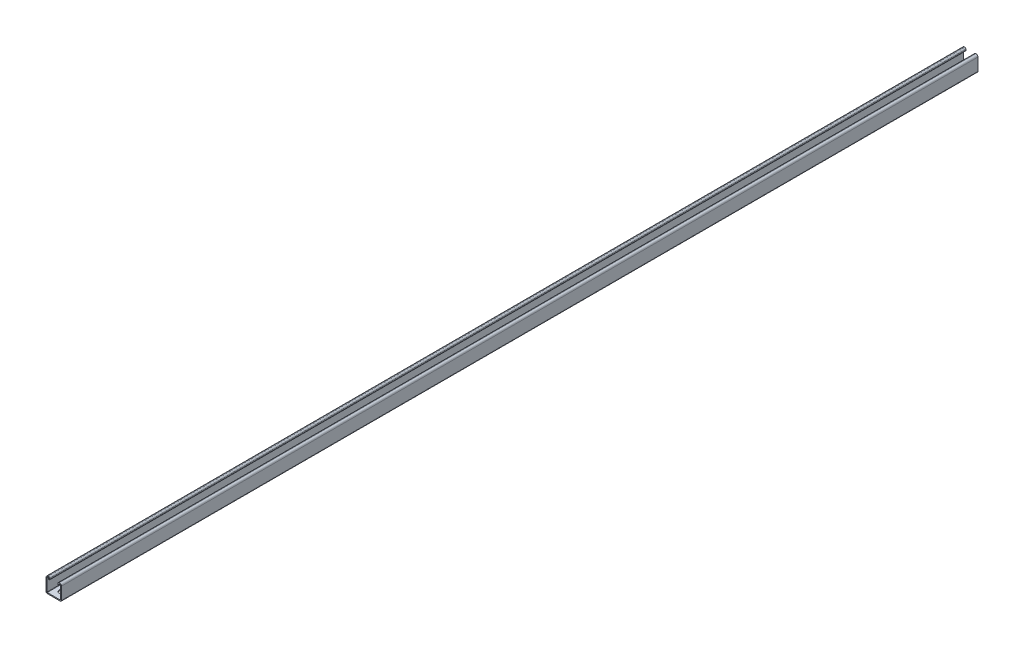
from build123d import *

# Parameters (mm, degrees)
PRIMARY_EXTRUSION_DEPTH = 2438.4
SLOT_CUT_REACH          = 2440.837
LPATTERN1_COUNT         = 48
LPATTERN1_PITCH         = 50.8


with BuildPart() as part:
    # Sketch1 → Primary Extrusion (new body)
    with BuildSketch(Plane.XY):
        with BuildLine():
            Line((17.176891111, -17.970376528), (-17.176891111, -17.970376528))
            ThreePointArc((-17.176891111, -17.970376528), (-17.738157147, -17.737892523), (-17.970641152, -17.176626487))
            Line((-17.970641152, -17.176626487), (-17.970641152, 15.589126408))
            ThreePointArc((-17.970641152, 15.589126408), (-17.273189139, 17.272924515), (-15.589391032, 17.970376528))
            Line((-15.589391032, 17.970376528), (-14.57342631, 17.970376528))
            ThreePointArc((-14.57342631, 17.970376528), (-14.012171972, 17.737897369), (-13.779692813, 17.176643031))
            Line((-13.779692813, 17.176643031), (-13.779692813, 14.833457753))
            ThreePointArc((-13.779692813, 14.833457753), (-12.446175174, 13.499940114), (-11.112657535, 14.833457753))
            Line((-11.112657535, 14.833457753), (-11.112657535, 17.176643031))
            ThreePointArc((-11.112657535, 17.176643031), (-12.126293241, 19.623776099), (-14.57342631, 20.637411806))
            Line((-14.57342631, 20.637411806), (-15.589391032, 20.637411806))
            ThreePointArc((-15.589391032, 20.637411806), (-19.15906787, 19.158803246), (-20.637676429, 15.589126408))
            Line((-20.637676429, 15.589126408), (-20.637676429, -17.176626487))
            ThreePointArc((-20.637676429, -17.176626487), (-19.624035878, -19.623771254), (-17.176891111, -20.637411806))
            Line((-17.176891111, -20.637411806), (17.176891111, -20.637411806))
            ThreePointArc((17.176891111, -20.637411806), (19.624035878, -19.623771254), (20.637676429, -17.176626487))
            Line((20.637676429, -17.176626487), (20.637676429, 15.589126408))
            ThreePointArc((20.637676429, 15.589126408), (19.15906787, 19.158803246), (15.589391032, 20.637411806))
            Line((15.589391032, 20.637411806), (14.57342631, 20.637411806))
            ThreePointArc((14.57342631, 20.637411806), (12.126293241, 19.623776099), (11.112657535, 17.176643031))
            Line((11.112657535, 17.176643031), (11.112657535, 14.833457753))
            ThreePointArc((11.112657535, 14.833457753), (12.446175174, 13.499940114), (13.779692813, 14.833457753))
            Line((13.779692813, 14.833457753), (13.779692813, 17.176643031))
            ThreePointArc((13.779692813, 17.176643031), (14.012171972, 17.737897369), (14.57342631, 17.970376528))
            Line((14.57342631, 17.970376528), (15.589391032, 17.970376528))
            ThreePointArc((15.589391032, 17.970376528), (17.273189139, 17.272924515), (17.970641152, 15.589126408))
            Line((17.970641152, 15.589126408), (17.970641152, -17.176626487))
            ThreePointArc((17.970641152, -17.176626487), (17.738157147, -17.737892523), (17.176891111, -17.970376528))
        make_face()
    extrude(amount=-PRIMARY_EXTRUSION_DEPTH)

    # Sketch58 → Slot Cut (cut, up to next)
    with BuildSketch(Plane(origin=(0, -20.637411806, 0), x_dir=(-1, 0, 0), z_dir=(0, 1, 0)), mode=Mode.PRIVATE) as slot_cut_sk1:
        with BuildLine():
            Line((7.14375, -29.36875), (7.14375, -21.43125))
            ThreePointArc((7.14375, -21.43125), (0, -14.2875), (-7.14375, -21.43125))
            Line((-7.14375, -21.43125), (-7.14375, -29.36875))
            ThreePointArc((-7.14375, -29.36875), (0, -36.5125), (7.14375, -29.36875))
        make_face()
    slot_cut_tool1 = extrude(slot_cut_sk1.sketch, amount=SLOT_CUT_REACH, mode=Mode.PRIVATE) & part.part
    slot_cut = slot_cut_tool1.solids().sort_by_distance((0, -20.637412, -25.4))[0]
    add(slot_cut, mode=Mode.SUBTRACT)

    # LPattern1: Slot Cut ×48
    with Locations(*[(0, 0, -i * LPATTERN1_PITCH) for i in range(1, LPATTERN1_COUNT)]):
        add(slot_cut, mode=Mode.SUBTRACT)


solid = part.part
